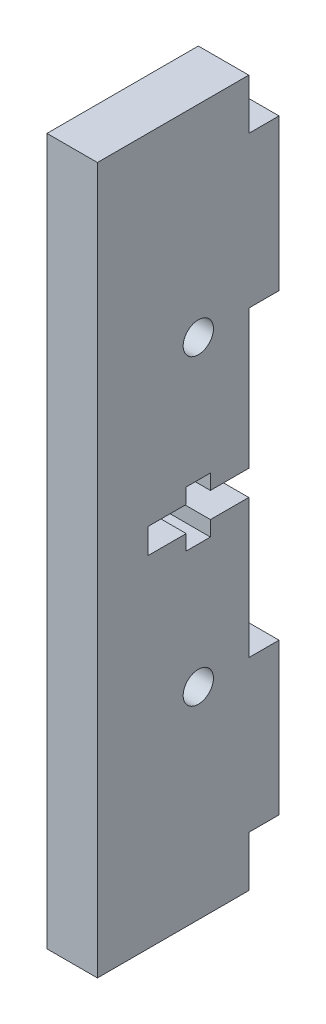
from build123d import *

# Parameters (mm, degrees)
SCHIZZO1_W                   = 15
SCHIZZO1_H                   = 70
ESTRUSIONE_ESTRUSIONE1_DEPTH = 5
SCHIZZO2_W                   = 5
SCHIZZO2_H                   = 15
ESTRUSIONE_ESTRUSIONE2_DEPTH = 3
SCHIZZO4_R                   = 1.5
TAGLIO_ESTRUSIONE2_DEPTH     = 37.881567212


with BuildPart() as part:
    # Schizzo1 → Estrusione-Estrusione1 (new body)
    with BuildSketch(Plane(origin=(0, 0, 0), x_dir=(0, 0, -1), z_dir=(1, 0, 0))):
        Rectangle(SCHIZZO1_W, SCHIZZO1_H)
    extrude(amount=ESTRUSIONE_ESTRUSIONE1_DEPTH)

    # Schizzo2 → Estrusione-Estrusione2 (add)
    with BuildSketch(Plane(origin=(0, 0, -7.5), x_dir=(-1, 0, 0), z_dir=(0, 0, -1))):
        with Locations((-2.5, 22.5)):
            Rectangle(SCHIZZO2_W, SCHIZZO2_H)
        with Locations((-2.5, -22.5)):
            Rectangle(SCHIZZO2_W, SCHIZZO2_H)
    extrude(amount=ESTRUSIONE_ESTRUSIONE2_DEPTH)

    # Schizzo4 → Taglio-Estrusione2 (cut, through all)
    with BuildSketch(Plane(origin=(0, 0, 0), x_dir=(0, 0, -1), z_dir=(1, 0, 0))):
        with Locations((2.5, 15)):
            Circle(SCHIZZO4_R)
        with Locations((2.5, -15)):
            Circle(SCHIZZO4_R)
        Polygon((-2.5, 1.25), (1.3, 1.25), (1.3, 2.75), (3.7, 2.75), (3.7, 1.25), (7.5, 1.25), (7.5, -1.25), (3.7, -1.25), (3.7, -2.75), (1.3, -2.75), (1.3, -1.25), (-2.5, -1.25), align=None)
    extrude(amount=TAGLIO_ESTRUSIONE2_DEPTH, mode=Mode.SUBTRACT)


solid = part.part
